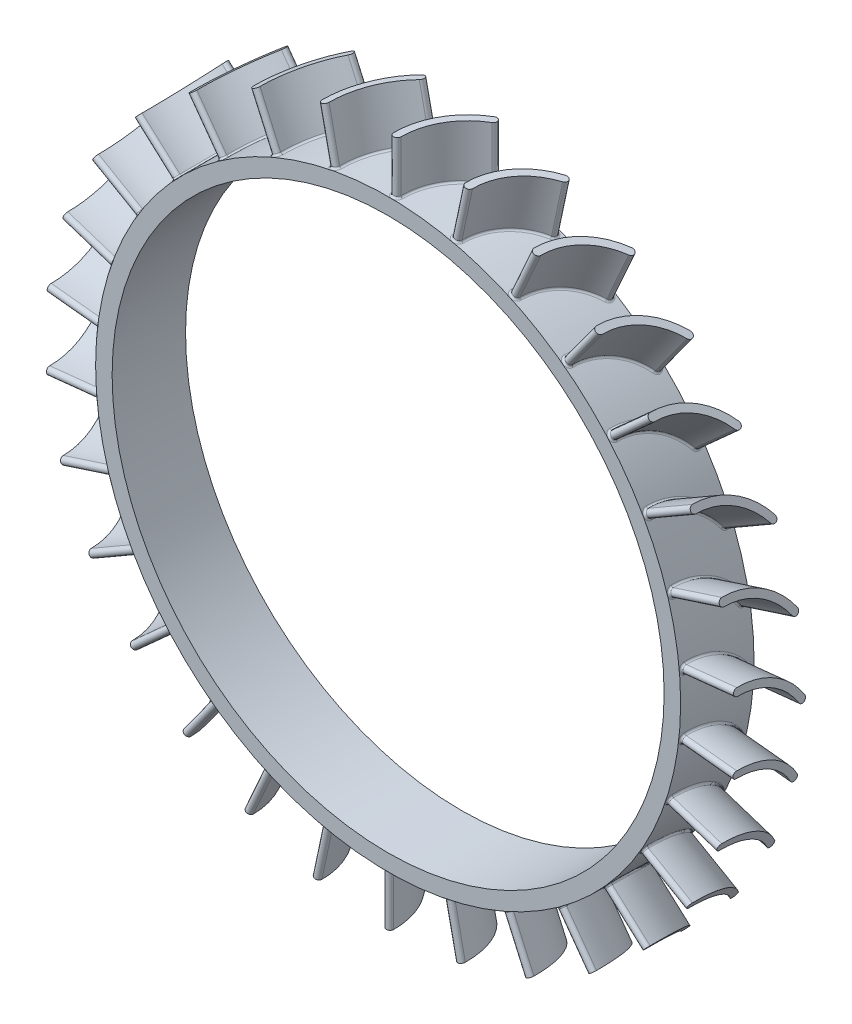
from build123d import *

# Parameters (mm, degrees)
SKETCH1_R                = 79.69
SKETCH1_R_2              = 75.19
BOSS_EXTRUDE1_DEPTH      = 10
BOSS_EXTRUDE2_START      = 77
BOSS_EXTRUDE2_DEPTH      = 17
FILLET1_R                = 0.5
CIRPATTERN1_COUNT        = 30
FILLET1_OF_CIRPATTERN1_R = 0.5


with BuildPart() as part:
    # Sketch1 → Boss-Extrude1 (new, symmetric)
    with BuildSketch(Plane.XY):
        Circle(SKETCH1_R)
        Circle(SKETCH1_R_2, mode=Mode.SUBTRACT)
    extrude(amount=BOSS_EXTRUDE1_DEPTH, both=True)

    # Sketch2 → Boss-Extrude2 (add)
    with BuildSketch(Plane(origin=(0, 0, 0), x_dir=(1, 0, 0), z_dir=(0, 1, 0)).offset(BOSS_EXTRUDE2_START)):
        with BuildLine():
            ThreePointArc((-0.010577151, -8.5), (2.628333879, 1.603645999), (10, 9))
            ThreePointArc((10, 9), (11.365785831, 8.633081666), (10.998867497, 7.267295835))
            ThreePointArc((10.998867497, 7.267295835), (4.364367988, 0.610577234), (1.989348061, -8.482704165))
            ThreePointArc((1.989348061, -8.482704165), (0.998033372, -9.491314689), (-0.010577151, -8.5))
        make_face()
    boss_extrude2 = extrude(amount=BOSS_EXTRUDE2_DEPTH)

    # Fillet1
    fillet1_edges = [part.edges().sort_by_distance(p)[0] for p in [
        (0.998084644, 79.683749454, 9.491314243),
        (2.633289493, 79.646480714, -1.612304138),
        (2.633289493, 79.646480714, -1.612304138),
        (4.370443678, 79.570065514, -0.621190071),
    ]]
    fillet(fillet1_edges, radius=FILLET1_R)

    # CirPattern1: Boss-Extrude2 ×30 about axis
    cirpattern1_axis = Axis((0, 0, 10), (0, 0, 1))
    for i in range(1, CIRPATTERN1_COUNT):
        add(boss_extrude2.rotate(cirpattern1_axis, i * 360 / CIRPATTERN1_COUNT))

    # Fillet1 of CirPattern1
    fillet1_of_cirpattern1_edges = [part.edges().sort_by_distance(p)[0] for p in [
        (-15.590908979, 78.149981812, 9.491314243),
        (-13.983688673, 78.453505688, -1.612304138),
        (-13.983688673, 78.453505688, -1.612304138),
        (-12.268607861, 78.739935007, -0.621190071),
        (-31.498505067, 73.200684959, 9.491314243),
        (-29.989512543, 73.831736002, -1.612304138),
        (-29.989512543, 73.831736002, -1.612304138),
        (-28.371462366, 74.468491505, -0.621190071),
        (-46.029465337, 65.052166918, 9.491314243),
        (-44.684650809, 65.983165169, -1.612304138),
        (-44.684650809, 65.983165169, -1.612304138),
        (-43.234347824, 66.942417584, -0.621190071),
        (-58.548717098, 54.060557028, 9.491314243),
        (-57.426855415, 55.250813395, -1.612304138),
        (-57.426855415, 55.250813395, -1.612304138),
        (-56.207684821, 56.49063879, -0.621190071),
        (-68.509108974, 40.706241384, 9.491314243),
        (-67.659230874, 42.103735954, -1.612304138),
        (-67.659230874, 42.103735954, -1.612304138),
        (-66.724476277, 43.569948008, -0.621190071),
        (-75.475324044, 25.572867662, 9.491314243),
        (-74.934573278, 27.116523215, -1.612304138),
        (-74.934573278, 27.116523215, -1.612304138),
        (-74.325087939, 28.745041426, -0.621190071),
        (-79.142905283, 9.32183691, 9.491314243),
        (-78.934915255, 10.944188292, -1.612304138),
        (-78.934915255, 10.944188292, -1.612304138),
        (-78.677336608, 12.663838601, -0.621190071),
        (-79.351561791, -7.336602845, 9.491314243),
        (-79.485422663, -5.706460176, -1.612304138),
        (-79.485422663, -5.706460176, -1.612304138),
        (-79.591008131, -3.97083474, -0.621190071),
        (-76.092174278, -23.674397852, 9.491314243),
        (-76.562035687, -22.107708951, -1.612304138),
        (-76.562035687, -22.107708951, -1.612304138),
        (-77.026170678, -20.431963548, -0.621190071),
        (-69.507193618, -38.97750807, 9.491314243),
        (-70.292520367, -37.54274476, -1.612304138),
        (-70.292520367, -37.54274476, -1.612304138),
        (-71.094919955, -36.000117506, -0.621190071),
        (-59.884415065, -52.57711415, 9.491314243),
        (-60.950884605, -51.336982473, -1.612304138),
        (-60.950884605, -51.336982473, -1.612304138),
        (-62.056480078, -49.994893581, -0.621190071),
        (-47.644400216, -63.878848049, 9.491314243),
        (-48.945402712, -62.88754771, -1.612304138),
        (-48.945402712, -62.88754771, -1.612304138),
        (-50.305874241, -61.804652904, -0.621190071),
        (-33.322096454, -72.388769764, 9.491314243),
        (-34.800771854, -71.689625345, -1.612304138),
        (-34.800771854, -71.689625345, -1.612304138),
        (-36.356660306, -70.913252324, -0.621190071),
        (-17.54345718, -77.73495488, 9.491314243),
        (-19.135180273, -77.358522346, -1.612304138),
        (-19.135180273, -77.358522346, -1.612304138),
        (-20.818485857, -76.922602338, -0.621190071),
        (-0.998084644, -79.683749454, 9.491314243),
        (-2.633289493, -79.646480714, -1.612304138),
        (-2.633289493, -79.646480714, -1.612304138),
        (-4.370443678, -79.570065514, -0.621190071),
        (15.590908979, -78.149981812, 9.491314243),
        (13.983688673, -78.453505688, -1.612304138),
        (13.983688673, -78.453505688, -1.612304138),
        (12.268607861, -78.739935007, -0.621190071),
        (31.498505067, -73.200684959, 9.491314243),
        (29.989512543, -73.831736002, -1.612304138),
        (29.989512543, -73.831736002, -1.612304138),
        (28.371462366, -74.468491505, -0.621190071),
        (46.029465337, -65.052166918, 9.491314243),
        (44.684650809, -65.983165169, -1.612304138),
        (44.684650809, -65.983165169, -1.612304138),
        (43.234347824, -66.942417584, -0.621190071),
        (58.548717098, -54.060557028, 9.491314243),
        (57.426855415, -55.250813395, -1.612304138),
        (57.426855415, -55.250813395, -1.612304138),
        (56.207684821, -56.49063879, -0.621190071),
        (68.509108974, -40.706241384, 9.491314243),
        (67.659230874, -42.103735954, -1.612304138),
        (67.659230874, -42.103735954, -1.612304138),
        (66.724476277, -43.569948008, -0.621190071),
        (75.475324044, -25.572867662, 9.491314243),
        (74.934573278, -27.116523215, -1.612304138),
        (74.934573278, -27.116523215, -1.612304138),
        (74.325087939, -28.745041426, -0.621190071),
        (79.142905283, -9.32183691, 9.491314243),
        (78.934915255, -10.944188292, -1.612304138),
        (78.934915255, -10.944188292, -1.612304138),
        (78.677336608, -12.663838601, -0.621190071),
        (79.351561791, 7.336602845, 9.491314243),
        (79.485422663, 5.706460176, -1.612304138),
        (79.485422663, 5.706460176, -1.612304138),
        (79.591008131, 3.97083474, -0.621190071),
        (76.092174278, 23.674397852, 9.491314243),
        (76.562035687, 22.107708951, -1.612304138),
        (76.562035687, 22.107708951, -1.612304138),
        (77.026170678, 20.431963548, -0.621190071),
        (69.507193618, 38.97750807, 9.491314243),
        (70.292520367, 37.54274476, -1.612304138),
        (70.292520367, 37.54274476, -1.612304138),
        (71.094919955, 36.000117506, -0.621190071),
        (59.884415065, 52.57711415, 9.491314243),
        (60.950884605, 51.336982473, -1.612304138),
        (60.950884605, 51.336982473, -1.612304138),
        (62.056480078, 49.994893581, -0.621190071),
        (47.644400216, 63.878848049, 9.491314243),
        (48.945402712, 62.88754771, -1.612304138),
        (48.945402712, 62.88754771, -1.612304138),
        (50.305874241, 61.804652904, -0.621190071),
        (33.322096454, 72.388769764, 9.491314243),
        (34.800771854, 71.689625345, -1.612304138),
        (34.800771854, 71.689625345, -1.612304138),
        (36.356660306, 70.913252324, -0.621190071),
        (17.54345718, 77.73495488, 9.491314243),
        (19.135180273, 77.358522346, -1.612304138),
        (19.135180273, 77.358522346, -1.612304138),
        (20.818485857, 76.922602338, -0.621190071),
    ]]
    fillet(fillet1_of_cirpattern1_edges, radius=FILLET1_OF_CIRPATTERN1_R)


solid = part.part
